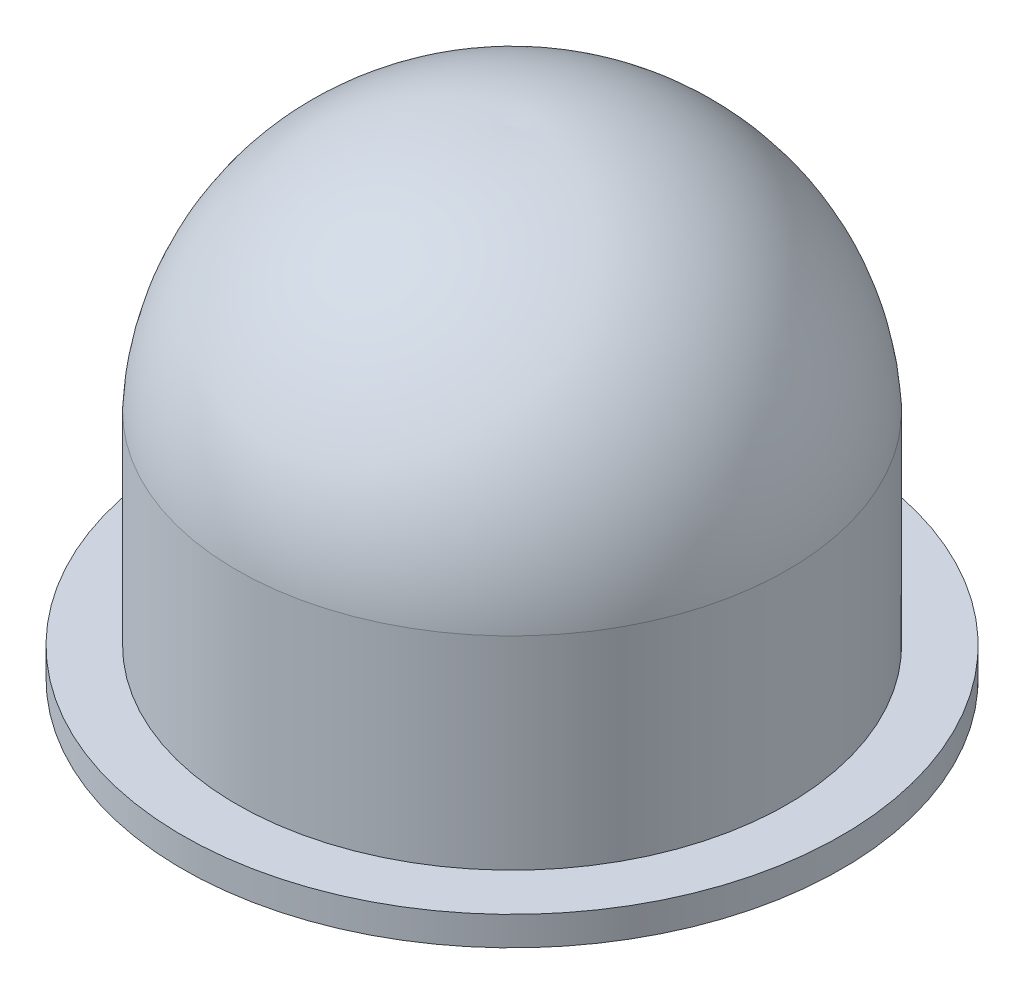
from build123d import *


with BuildPart() as part:
    # Sketch1 → Revolve1 (revolve)
    with BuildSketch(Plane.XY):
        with BuildLine():
            Line((6.8, 0.8), (3, 0.8))
            Line((3, 0.8), (3, 0))
            Line((3, 0), (9.092958105, 0))
            Line((9.092958105, 0), (9.092958105, 0.8))
            Line((9.092958105, 0.8), (7.6, 0.8))
            Line((7.6, 0.8), (7.6, 6.396920003))
            ThreePointArc((7.6, 6.396920003), (5.209601889, 11.374011537), (0, 13.203079997))
            Line((0, 13.203079997), (0, 12.612286059))
            ThreePointArc((0, 12.612286059), (4.687244458, 10.912929143), (6.8, 6.396920003))
            Line((6.8, 6.396920003), (6.8, 0.8))
        make_face()
    revolve(axis=Axis((0, 16.642933642, 0), (0, -1, 0)))


solid = part.part
